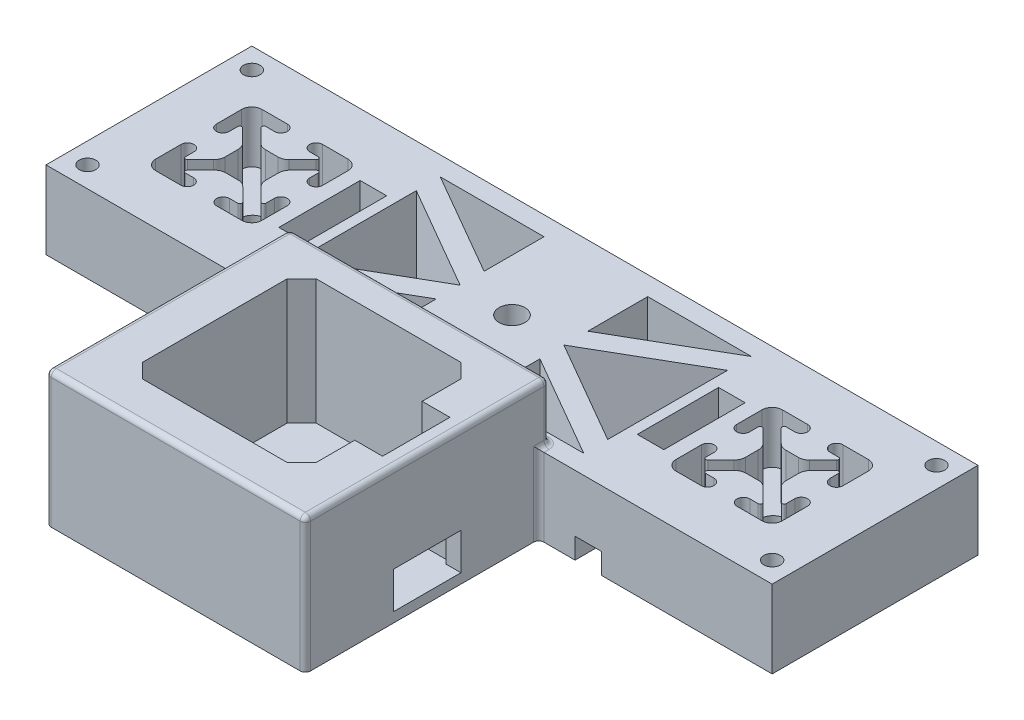
from build123d import *

# Parameters (mm, degrees)
SKETCH1_W               = 177.8
SKETCH1_H               = 50.4000008
BOSS_EXTRUDE1_DEPTH     = 6.35
SKETCH2_W               = 177.8
SKETCH2_H               = 50.4000008
BOSS_EXTRUDE2_DEPTH     = 12.7
SKETCH3_R               = 3.175
CUT_EXTRUDE1_DEPTH      = 186.784559586
CUT_EXTRUDE2_DEPTH      = 186.784559586
SKETCH5_W               = 6.5
SKETCH5_H               = 19.9
CUT_EXTRUDE3_DEPTH      = 10.2
SKETCH6_W               = 6.5
SKETCH6_H               = 4.572
CUT_EXTRUDE4_DEPTH      = 186.086574555
CUT_EXTRUDE5_DEPTH      = 186.241167349
CUT_EXTRUDE5_DEPTH_BACK = 186.241167349
SKETCH7_R               = 2.921
CUT_EXTRUDE6_DEPTH      = 186.241167349
CUT_EXTRUDE6_DEPTH_BACK = 186.241167349
SKETCH8_R               = 2.921
CHAMFER2_SIZE           = 3.302
CHAMFER3_SIZE           = 3.302
CUT_EXTRUDE8_DEPTH      = 5.08
BOSS_EXTRUDE4_DEPTH     = 33.02
CUT_EXTRUDE9_DEPTH      = 30.6
SKETCH13_W              = 16.5
SKETCH13_H              = 9
CUT_EXTRUDE10_DEPTH     = 30.6
FILLET1_R               = 1.27
SKETCH14_R              = 2.921
CUT_EXTRUDE11_DEPTH     = 190.249365917
SKETCH15_R              = 7.62
CUT_EXTRUDE12_DEPTH     = 8.128
SKETCH16_R              = 2.032
CUT_EXTRUDE13_DEPTH     = 188.728167838


with BuildPart() as part:
    # Sketch1 → Boss-Extrude1 (new body)
    with BuildSketch(Plane(origin=(0, 0, 0), x_dir=(1, 0, 0), z_dir=(0, 1, 0))):
        with Locations((88.9, 25.2000004)):
            Rectangle(SKETCH1_W, SKETCH1_H)
    extrude(amount=BOSS_EXTRUDE1_DEPTH)

    # Sketch2 → Boss-Extrude2 (add)
    with BuildSketch(Plane(origin=(0, 6.35, 0), x_dir=(1, 0, 0), z_dir=(0, 1, 0))):
        with Locations((88.9, 25.2000004)):
            Rectangle(SKETCH2_W, SKETCH2_H)
        with BuildLine():
            Line((38.207602115, 29.52001185), (38.207602115, 35.7371571))
            ThreePointArc((38.207602115, 35.7371571), (37.48390875, 37.484307436), (35.736758415, 38.2080008))
            Line((35.736758415, 38.2080008), (29.519613165, 38.2080008))
            ThreePointArc((29.519613165, 38.2080008), (27.941613165, 36.6300008), (29.519613165, 35.0520008))
            Line((29.519613165, 35.0520008), (31.618952135, 35.0520008))
            ThreePointArc((31.618952135, 35.0520008), (32.082805957, 34.741944038), (31.973665066, 34.194784253))
            Line((31.973665066, 34.194784253), (28.637609194, 30.863479703))
            ThreePointArc((28.637609194, 30.863479703), (27.774459736, 30.287408726), (26.756632806, 30.085138862))
            Line((26.756632806, 30.085138862), (23.642969309, 30.085138862))
            ThreePointArc((23.642969309, 30.085138862), (22.625142379, 30.287408726), (21.761992921, 30.863479703))
            Line((21.761992921, 30.863479703), (18.425937049, 34.194784253))
            ThreePointArc((18.425937049, 34.194784253), (18.316796158, 34.741944038), (18.78064998, 35.0520008))
            Line((18.78064998, 35.0520008), (20.87998895, 35.0520008))
            ThreePointArc((20.87998895, 35.0520008), (22.45798895, 36.6300008), (20.87998895, 38.2080008))
            Line((20.87998895, 38.2080008), (14.6628437, 38.2080008))
            ThreePointArc((14.6628437, 38.2080008), (12.915693364, 37.484307436), (12.192, 35.7371571))
            Line((12.192, 35.7371571), (12.192, 29.52001185))
            ThreePointArc((12.192, 29.52001185), (13.77, 27.94201185), (15.348, 29.52001185))
            Line((15.348, 29.52001185), (15.348, 31.596493464))
            ThreePointArc((15.348, 31.596493464), (15.657726258, 32.060210386), (16.204710632, 31.95171231))
            Line((16.204710632, 31.95171231), (19.406929995, 28.754053655))
            ThreePointArc((19.406929995, 28.754053655), (20.019806023, 27.837880259), (20.235040084, 26.756832148))
            Line((20.235040084, 26.756832148), (20.235040084, 23.643168652))
            ThreePointArc((20.235040084, 23.643168652), (20.019806023, 22.562120541), (19.406929995, 21.645947145))
            Line((19.406929995, 21.645947145), (16.204710632, 18.44828849))
            ThreePointArc((16.204710632, 18.44828849), (15.657726258, 18.339790414), (15.348, 18.803507336))
            Line((15.348, 18.803507336), (15.348, 20.87998895))
            ThreePointArc((15.348, 20.87998895), (13.77, 22.45798895), (12.192, 20.87998895))
            Line((12.192, 20.87998895), (12.192, 14.6628437))
            ThreePointArc((12.192, 14.6628437), (12.915693364, 12.915693364), (14.6628437, 12.192))
            Line((14.6628437, 12.192), (20.812064149, 12.192))
            ThreePointArc((20.812064149, 12.192), (22.390064149, 13.77), (20.812064149, 15.348))
            Line((20.812064149, 15.348), (18.78064998, 15.348))
            ThreePointArc((18.78064998, 15.348), (18.316796158, 15.658056762), (18.425937049, 16.205216547))
            Line((18.425937049, 16.205216547), (21.761992921, 19.536521097))
            ThreePointArc((21.761992921, 19.536521097), (22.625142379, 20.112592074), (23.642969309, 20.314861938))
            Line((23.642969309, 20.314861938), (26.756632806, 20.314861938))
            ThreePointArc((26.756632806, 20.314861938), (27.774459736, 20.112592074), (28.637609194, 19.536521097))
            Line((28.637609194, 19.536521097), (31.973665066, 16.205216547))
            ThreePointArc((31.973665066, 16.205216547), (32.082805957, 15.658056762), (31.618952135, 15.348))
            Line((31.618952135, 15.348), (29.587537966, 15.348))
            ThreePointArc((29.587537966, 15.348), (28.009537966, 13.77), (29.587537966, 12.192))
            Line((29.587537966, 12.192), (35.736758415, 12.192))
            ThreePointArc((35.736758415, 12.192), (37.48390875, 12.915693364), (38.207602115, 14.6628437))
            Line((38.207602115, 14.6628437), (38.207602115, 20.87998895))
            ThreePointArc((38.207602115, 20.87998895), (36.629602115, 22.45798895), (35.051602115, 20.87998895))
            Line((35.051602115, 20.87998895), (35.051602115, 18.803507336))
            ThreePointArc((35.051602115, 18.803507336), (34.741875857, 18.339790414), (34.194891482, 18.44828849))
            Line((34.194891482, 18.44828849), (30.99267212, 21.645947145))
            ThreePointArc((30.99267212, 21.645947145), (30.379796092, 22.562120541), (30.16456203, 23.643168652))
            Line((30.16456203, 23.643168652), (30.16456203, 26.756832148))
            ThreePointArc((30.16456203, 26.756832148), (30.379796092, 27.837880259), (30.99267212, 28.754053655))
            Line((30.99267212, 28.754053655), (34.194891482, 31.95171231))
            ThreePointArc((34.194891482, 31.95171231), (34.741875857, 32.060210386), (35.051602115, 31.596493464))
            Line((35.051602115, 31.596493464), (35.051602115, 29.52001185))
            ThreePointArc((35.051602115, 29.52001185), (36.629602115, 27.94201185), (38.207602115, 29.52001185))
        make_face(mode=Mode.SUBTRACT)
        with BuildLine():
            Line((142.748397885, 31.596493464), (142.748397885, 29.52001185))
            ThreePointArc((142.748397885, 29.52001185), (141.170397885, 27.94201185), (139.592397885, 29.52001185))
            Line((139.592397885, 29.52001185), (139.592397885, 35.7371571))
            ThreePointArc((139.592397885, 35.7371571), (140.31609125, 37.484307436), (142.063241585, 38.2080008))
            Line((142.063241585, 38.2080008), (148.280386835, 38.2080008))
            ThreePointArc((148.280386835, 38.2080008), (149.858386835, 36.6300008), (148.280386835, 35.0520008))
            Line((148.280386835, 35.0520008), (146.181047865, 35.0520008))
            ThreePointArc((146.181047865, 35.0520008), (145.717194043, 34.741944038), (145.826334934, 34.194784253))
            Line((145.826334934, 34.194784253), (149.162390806, 30.863479703))
            ThreePointArc((149.162390806, 30.863479703), (150.025540264, 30.287408726), (151.043367194, 30.085138862))
            Line((151.043367194, 30.085138862), (154.157030691, 30.085138862))
            ThreePointArc((154.157030691, 30.085138862), (155.174857621, 30.287408726), (156.038007079, 30.863479703))
            Line((156.038007079, 30.863479703), (159.374062951, 34.194784253))
            ThreePointArc((159.374062951, 34.194784253), (159.483203842, 34.741944038), (159.01935002, 35.0520008))
            Line((159.01935002, 35.0520008), (156.92001105, 35.0520008))
            ThreePointArc((156.92001105, 35.0520008), (155.34201105, 36.6300008), (156.92001105, 38.2080008))
            Line((156.92001105, 38.2080008), (163.1371563, 38.2080008))
            ThreePointArc((163.1371563, 38.2080008), (164.884306636, 37.484307436), (165.608, 35.7371571))
            Line((165.608, 35.7371571), (165.608, 29.52001185))
            ThreePointArc((165.608, 29.52001185), (164.03, 27.94201185), (162.452, 29.52001185))
            Line((162.452, 29.52001185), (162.452, 31.596493464))
            ThreePointArc((162.452, 31.596493464), (162.142273742, 32.060210386), (161.595289368, 31.95171231))
            Line((161.595289368, 31.95171231), (158.393070005, 28.754053655))
            ThreePointArc((158.393070005, 28.754053655), (157.780193977, 27.837880259), (157.564959916, 26.756832148))
            Line((157.564959916, 26.756832148), (157.564959916, 23.643168652))
            ThreePointArc((157.564959916, 23.643168652), (157.780193977, 22.562120541), (158.393070005, 21.645947145))
            Line((158.393070005, 21.645947145), (161.595289368, 18.44828849))
            ThreePointArc((161.595289368, 18.44828849), (162.142273742, 18.339790414), (162.452, 18.803507336))
            Line((162.452, 18.803507336), (162.452, 20.87998895))
            ThreePointArc((162.452, 20.87998895), (164.03, 22.45798895), (165.608, 20.87998895))
            Line((165.608, 20.87998895), (165.608, 14.6628437))
            ThreePointArc((165.608, 14.6628437), (164.884306636, 12.915693364), (163.1371563, 12.192))
            Line((163.1371563, 12.192), (156.987935851, 12.192))
            ThreePointArc((156.987935851, 12.192), (155.409935851, 13.77), (156.987935851, 15.348))
            Line((156.987935851, 15.348), (159.01935002, 15.348))
            ThreePointArc((159.01935002, 15.348), (159.483203842, 15.658056762), (159.374062951, 16.205216547))
            Line((159.374062951, 16.205216547), (156.038007079, 19.536521097))
            ThreePointArc((156.038007079, 19.536521097), (155.174857621, 20.112592074), (154.157030691, 20.314861938))
            Line((154.157030691, 20.314861938), (151.043367194, 20.314861938))
            ThreePointArc((151.043367194, 20.314861938), (150.025540264, 20.112592074), (149.162390806, 19.536521097))
            Line((149.162390806, 19.536521097), (145.826334934, 16.205216547))
            ThreePointArc((145.826334934, 16.205216547), (145.717194043, 15.658056762), (146.181047865, 15.348))
            Line((146.181047865, 15.348), (148.212462034, 15.348))
            ThreePointArc((148.212462034, 15.348), (149.790462034, 13.77), (148.212462034, 12.192))
            Line((148.212462034, 12.192), (142.063241585, 12.192))
            ThreePointArc((142.063241585, 12.192), (140.31609125, 12.915693364), (139.592397885, 14.6628437))
            Line((139.592397885, 14.6628437), (139.592397885, 20.87998895))
            ThreePointArc((139.592397885, 20.87998895), (141.170397885, 22.45798895), (142.748397885, 20.87998895))
            Line((142.748397885, 20.87998895), (142.748397885, 18.803507336))
            ThreePointArc((142.748397885, 18.803507336), (143.058124143, 18.339790414), (143.605108518, 18.44828849))
            Line((143.605108518, 18.44828849), (146.80732788, 21.645947145))
            ThreePointArc((146.80732788, 21.645947145), (147.420203908, 22.562120541), (147.63543797, 23.643168652))
            Line((147.63543797, 23.643168652), (147.63543797, 26.756832148))
            ThreePointArc((147.63543797, 26.756832148), (147.420203908, 27.837880259), (146.80732788, 28.754053655))
            Line((146.80732788, 28.754053655), (143.605108518, 31.95171231))
            ThreePointArc((143.605108518, 31.95171231), (143.058124143, 32.060210386), (142.748397885, 31.596493464))
        make_face(mode=Mode.SUBTRACT)
    extrude(amount=BOSS_EXTRUDE2_DEPTH)

    # Sketch3 → Cut-Extrude1 (cut, through all)
    with BuildSketch(Plane(origin=(0, 19.05, 0), x_dir=(1, 0, 0), z_dir=(0, 1, 0))):
        with Locations((88.9, 25.2000004)):
            Circle(SKETCH3_R)
    extrude(amount=-CUT_EXTRUDE1_DEPTH, mode=Mode.SUBTRACT)

    # Sketch4 → Cut-Extrude2 (cut, through all)
    with BuildSketch(Plane(origin=(0, 19.05, 0), x_dir=(1, 0, 0), z_dir=(0, 1, 0))):
        Polygon((50.8, 45.730575972), (76.2, 45.730575972), (76.2, 31.065879135), align=None)
        Polygon((76.2, 19.334121665), (76.2, 4.669424828), (50.8, 4.669424828), align=None)
        Polygon((50.8, 39.864697237), (50.8, 10.535303563), (76.2, 25.2000004), align=None)
        Polygon((101.6, 25.2000004), (127, 39.864697237), (127, 10.535303563), align=None)
        Polygon((127, 4.669424828), (101.6, 19.334121665), (101.6, 4.669424828), align=None)
        Polygon((101.6, 31.065879135), (127, 45.730575972), (101.6, 45.730575972), align=None)
    extrude(amount=-CUT_EXTRUDE2_DEPTH, mode=Mode.SUBTRACT)

    # Sketch5 → Cut-Extrude3 (cut)
    with BuildSketch(Plane(origin=(0, 19.05, 0), x_dir=(1, 0, 0), z_dir=(0, 1, 0))):
        with Locations((45.013602115, 25.2000004)):
            Rectangle(SKETCH5_W, SKETCH5_H)
    cut_extrude3 = extrude(amount=-CUT_EXTRUDE3_DEPTH, mode=Mode.SUBTRACT)

    # Sketch6 → Cut-Extrude4 (cut, through all)
    with BuildSketch(Plane(origin=(0, 8.85, 0), x_dir=(1, 0, 0), z_dir=(0, 1, 0))):
        with Locations((45.013602115, 32.8640004)):
            Rectangle(SKETCH6_W, SKETCH6_H)
        with Locations((45.013602115, 25.2000004)):
            Rectangle(SKETCH6_W, SKETCH6_H)
        with Locations((45.013602115, 17.5360004)):
            Rectangle(SKETCH6_W, SKETCH6_H)
    cut_extrude4 = extrude(amount=-CUT_EXTRUDE4_DEPTH, mode=Mode.SUBTRACT)

    # Mirror1: Cut-Extrude3, Cut-Extrude4 across plane
    add(cut_extrude3.mirror(Plane.ZY.offset(-88.9)), mode=Mode.SUBTRACT)
    add(cut_extrude4.mirror(Plane.ZY.offset(-88.9)), mode=Mode.SUBTRACT)

    # Sketch7 → Cut-Extrude5 (cut, two sides: drawn at the far end of the back side and taken through both)
    with BuildSketch(Plane(origin=(0, 6.35, 0), x_dir=(1, 0, 0), z_dir=(0, 1, 0)).offset(-CUT_EXTRUDE5_DEPTH_BACK)):
        with Locations((25.33856203, 25.259138862)):
            Circle(SKETCH7_R)
    extrude(amount=CUT_EXTRUDE5_DEPTH + CUT_EXTRUDE5_DEPTH_BACK, mode=Mode.SUBTRACT)

    # Sketch8 → Cut-Extrude6 (cut, two sides: drawn at the far end of the back side and taken through both)
    with BuildSketch(Plane(origin=(0, 6.35, 0), x_dir=(1, 0, 0), z_dir=(0, 1, 0)).offset(-CUT_EXTRUDE6_DEPTH_BACK)):
        with Locations((152.738959916, 25.259138862)):
            Circle(SKETCH8_R)
    extrude(amount=CUT_EXTRUDE6_DEPTH + CUT_EXTRUDE6_DEPTH_BACK, mode=Mode.SUBTRACT)

    # Chamfer2
    chamfer2_edges = [part.edges().sort_by_distance(p)[0] for p in [
        (149.817959916, 0, -25.259138862),
    ]]
    chamfer(chamfer2_edges, length=CHAMFER2_SIZE)

    # Chamfer3
    chamfer3_edges = [part.edges().sort_by_distance(p)[0] for p in [
        (22.41756203, 0, -25.259138862),
    ]]
    chamfer(chamfer3_edges, length=CHAMFER3_SIZE)

    # Sketch11 → Cut-Extrude8 (cut)
    with BuildSketch(Plane(origin=(0, 0, 0), x_dir=(1, 0, 0), z_dir=(0, 1, 0))):
        Polygon((41.763602115, 15.2500004), (41.763602115, 0), (48.263602115, 0), (48.263602115, 15.2500004), (48.263602115, 35.1500004), (48.263602115, 50.4000008), (41.763602115, 50.4000008), (41.763602115, 35.1500004), align=None)
        Polygon((136.036397885, 0), (129.536397885, 0), (129.536397885, 15.2500004), (129.536397885, 35.1500004), (129.536397885, 50.4000008), (136.036397885, 50.4000008), (136.036397885, 35.1500004), (136.036397885, 15.2500004), align=None)
    extrude(amount=CUT_EXTRUDE8_DEPTH, mode=Mode.SUBTRACT)

    # Sketch9 → Boss-Extrude4 (add)
    with BuildSketch(Plane(origin=(0, 0, 0), x_dir=(1, 0, 0), z_dir=(0, 1, 0))):
        Polygon((120.65, 0), (120.65, -57.15), (57.15, -57.15), (57.15, 0), (57.15, 2.54), (120.65, 2.54), align=None)
    extrude(amount=BOSS_EXTRUDE4_DEPTH)

    # Sketch12 → Cut-Extrude9 (cut)
    with BuildSketch(Plane(origin=(0, 33.02, 0), x_dir=(1, 0, 0), z_dir=(0, 1, 0))):
        Polygon((71.185533906, -5.0499996), (106.614466094, -5.0499996), (110.15, -8.585533506), (110.15, -18.0499996), (116.95, -18.0499996), (116.95, -34.5499996), (110.15, -34.5499996), (110.15, -44.014465694), (106.614466094, -47.5499996), (71.185533906, -47.5499996), (67.65, -44.014465694), (67.65, -8.585533506), align=None)
    extrude(amount=-CUT_EXTRUDE9_DEPTH, mode=Mode.SUBTRACT)

    # Sketch13 → Cut-Extrude10 (cut)
    with BuildSketch(Plane(origin=(120.65, 0, 0), x_dir=(0, 0, -1), z_dir=(1, 0, 0))):
        with Locations((-27.305, 6.92)):
            Rectangle(SKETCH13_W, SKETCH13_H)
    extrude(amount=-CUT_EXTRUDE10_DEPTH, mode=Mode.SUBTRACT)

    # Fillet1
    fillet1_edges = [part.edges().sort_by_distance(p)[0] for p in [
        (120.65, 19.05, -1.27),
        (57.15, 19.05, -1.27),
        (120.65, 26.035, -2.54),
        (57.15, 26.035, -2.54),
        (88.9, 19.05, -2.54),
        (57.15, 9.525, 0),
        (120.65, 9.525, 0),
        (120.65, 33.02, 27.305),
        (120.65, 16.51, 57.15),
        (88.9, 33.02, 57.15),
        (57.15, 33.02, 27.305),
        (57.15, 16.51, 57.15),
        (88.9, 33.02, -2.54),
    ]]
    fillet(fillet1_edges, radius=FILLET1_R)

    # Sketch14 → Cut-Extrude11 (cut, through all)
    with BuildSketch(Plane(origin=(0, 2.42, 0), x_dir=(1, 0, 0), z_dir=(0, 1, 0))):
        with Locations((88.9, -26.2999996)):
            Circle(SKETCH14_R)
    extrude(amount=-CUT_EXTRUDE11_DEPTH, mode=Mode.SUBTRACT)

    # Sketch15 → Cut-Extrude12 (cut)
    with BuildSketch(Plane(origin=(0, 0, 0), x_dir=(1, 0, 0), z_dir=(0, 1, 0))):
        with Locations((88.9, 25.2000004)):
            Circle(SKETCH15_R)
    extrude(amount=CUT_EXTRUDE12_DEPTH, mode=Mode.SUBTRACT)

    # Sketch16 → Cut-Extrude13 (cut, through all)
    with BuildSketch(Plane(origin=(0, 19.05, 0), x_dir=(1, 0, 0), z_dir=(0, 1, 0))):
        with Locations((5.08, 45.3200008)):
            Circle(SKETCH16_R)
        with Locations((5.08, 5.08)):
            Circle(SKETCH16_R)
        with Locations((172.72, 5.08)):
            Circle(SKETCH16_R)
        with Locations((172.72, 45.3200008)):
            Circle(SKETCH16_R)
    extrude(amount=-CUT_EXTRUDE13_DEPTH, mode=Mode.SUBTRACT)


solid = part.part
